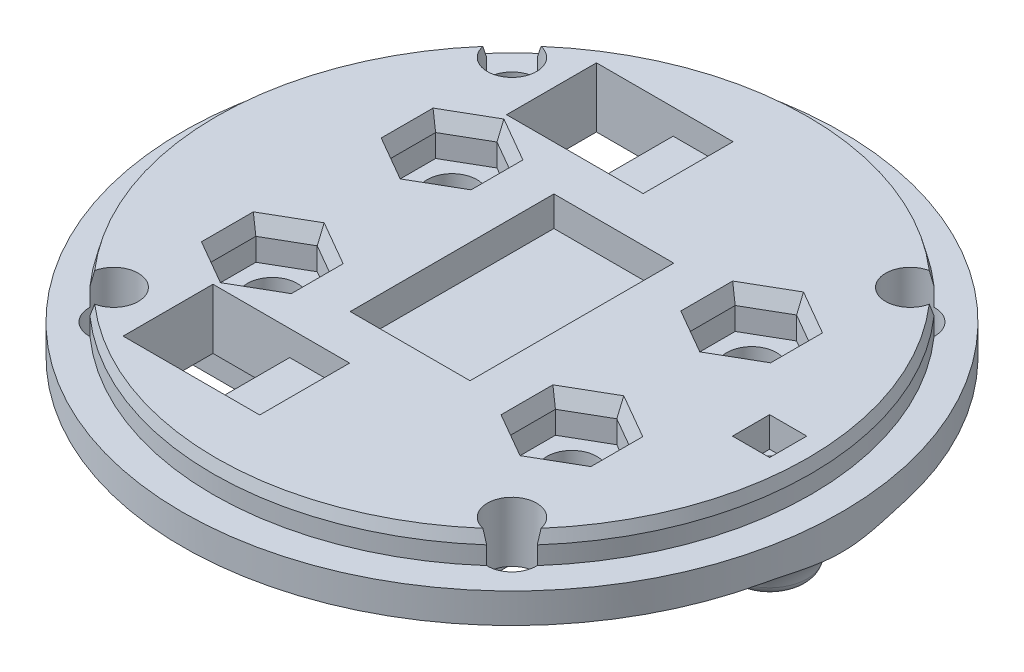
from build123d import *
from OCP.BRepFilletAPI import BRepFilletAPI_MakeChamfer

# Parameters (mm, degrees)
SKETCH_1_R          = 55
EXTRUDE_1_DEPTH     = 5
SKETCH_2_R          = 49.9
EXTRUDE_2_DEPTH     = 5
SKETCH_3_W          = 35
SKETCH_3_H          = 45
EXTRUDE_3_DEPTH     = 25
SKETCH_4_W          = 20.2
SKETCH_4_H          = 10.3
CUT_EXTRUDE_1_DEPTH = 99.266220035
SKETCH_5_R          = 4.1
CUT_EXTRUDE_2_DEPTH = 82.700673192
SKETCH_6_R          = 2.75
CUT_EXTRUDE_3_DEPTH = 86.293610546
CHAMFER1_SIZE       = 2
CHAMFER1_SIZE2      = 0.535898385
SKETCH2_W           = 35.065209797
SKETCH2_H           = 45
CUT_EXTRUDE1_DEPTH  = 12.5
BOSS_EXTRUDE1_START = -2
SKETCH4_W           = 70
SKETCH4_H           = 45
BOSS_EXTRUDE1_DEPTH = 5.35
SKETCH5_R           = 4.15
CUT_EXTRUDE2_DEPTH  = 80.281917882
CUT_EXTRUDE3_DEPTH  = 6.5
SKETCH7_W           = 20
SKETCH7_H           = 34
CUT_EXTRUDE4_DEPTH  = 5
CHAMFER2_SIZE       = 1
CHAMFER2_SIZE2      = 2.747477419
SKETCH8_R           = 2.1
CUT_EXTRUDE5_DEPTH  = 79.779756283
CUT_EXTRUDE5_DRAFT  = 2
SKETCH9_W           = 6.2
SKETCH9_H           = 6.2
CUT_EXTRUDE6_DEPTH  = 5
CHAMFER3_SIZE       = 0.7
CHAMFER3_SIZE2      = 2.128636439
SKETCH10_R          = 6
SKETCH10_R_2        = 3
BOSS_EXTRUDE2_DEPTH = 9
FILLET1_R           = 10
FILLET2_R           = 2
SKETCH11_W          = 12.8
SKETCH11_H          = 15
CUT_EXTRUDE7_DEPTH  = 79.779756353
SKETCH13_W          = 10
SKETCH13_H          = 15
CUT_EXTRUDE8_DEPTH  = 4.2


with BuildPart() as part:
    # Эскиз1 → Бобышка-Вытянуть1 (new body)
    with BuildSketch(Plane(origin=(0, 0, 0), x_dir=(1, 0, 0), z_dir=(0, 1, 0))):
        with Locations(Location((0, 0, 0), (0, 0, 270))):
            Circle(SKETCH_1_R)
    extrude(amount=EXTRUDE_1_DEPTH)

    # Эскиз2 → Бобышка-Вытянуть2 (add)
    with BuildSketch(Plane(origin=(0, 5, 0), x_dir=(1, 0, 0), z_dir=(0, 1, 0))):
        with Locations(Location((0, 0, 0), (0, 0, 270))):
            Circle(SKETCH_2_R)
    extrude(amount=EXTRUDE_2_DEPTH)

    # Эскиз3 → Бобышка-Вытянуть3 (add)
    with BuildSketch(Plane.XZ):
        Rectangle(SKETCH_3_W, SKETCH_3_H)
    extrude(amount=EXTRUDE_3_DEPTH)

    # Эскиз4 → Вырез-Вытянуть1 (cut, through all)
    with BuildSketch(Plane.XY.offset(22.5)):
        with Locations((0, -12.5)):
            Rectangle(SKETCH_4_W, SKETCH_4_H)
    extrude(amount=-CUT_EXTRUDE_1_DEPTH, mode=Mode.SUBTRACT)

    # Эскиз5 → Вырез-Вытянуть2 (cut, through all)
    with BuildSketch(Plane.XZ):
        with Locations(Location((33.234018718, -33.234018718, 0), (0, 0, 270))):
            Circle(SKETCH_5_R)
        with Locations(Location((-33.234018718, -33.234018718, 0), (0, 0, 270))):
            Circle(SKETCH_5_R)
        with Locations(Location((-33.234018718, 33.234018718, 0), (0, 0, 270))):
            Circle(SKETCH_5_R)
        with Locations(Location((33.234018718, 33.234018718, 0), (0, 0, 270))):
            Circle(SKETCH_5_R)
    extrude(amount=-CUT_EXTRUDE_2_DEPTH, mode=Mode.SUBTRACT)

    # Эскиз6 → Вырез-Вытянуть3 (cut, through all)
    with BuildSketch(Plane(origin=(0, 10, 0), x_dir=(1, 0, 0), z_dir=(0, 1, 0))):
        with Locations(Location((-18, 28, 0), (0, 0, 270))):
            Circle(SKETCH_6_R)
    extrude(amount=-CUT_EXTRUDE_3_DEPTH, mode=Mode.SUBTRACT)

    # Chamfer1: one chamfer whose edges measure the first distance from different faces: ONE call of the kernel's chamfer builder (chamfer() names one face for all edges)
    chamfer1_edges_1 = [part.edges().sort_by_distance(p)[0] for p in [
        (0, 10, -49.9),
    ]]
    chamfer1_side_1 = [part.faces().sort_by_distance(p)[0] for p in [
        (0, 7.5, -49.9),
    ]]
    chamfer1_edges_2 = [part.edges().sort_by_distance(p)[0] for p in [
        (-49.9, 10, 0),
    ]]
    chamfer1_side_2 = [part.faces().sort_by_distance(p)[0] for p in [
        (-49.9, 7.5, 0),
    ]]
    chamfer1_edges_3 = [part.edges().sort_by_distance(p)[0] for p in [
        (0, 10, 49.9),
    ]]
    chamfer1_side_3 = [part.faces().sort_by_distance(p)[0] for p in [
        (0, 7.5, 49.9),
    ]]
    chamfer1_edges_4 = [part.edges().sort_by_distance(p)[0] for p in [
        (49.9, 10, 0),
    ]]
    chamfer1_side_4 = [part.faces().sort_by_distance(p)[0] for p in [
        (49.9, 7.5, 0),
    ]]
    chamfer1 = BRepFilletAPI_MakeChamfer(part.part.solid().wrapped)
    for e in chamfer1_edges_1:
        chamfer1.Add(CHAMFER1_SIZE, CHAMFER1_SIZE2, e.wrapped, chamfer1_side_1[0].wrapped)  # the first distance lies on this face
    for e in chamfer1_edges_2:
        chamfer1.Add(CHAMFER1_SIZE, CHAMFER1_SIZE2, e.wrapped, chamfer1_side_2[0].wrapped)  # the first distance lies on this face
    for e in chamfer1_edges_3:
        chamfer1.Add(CHAMFER1_SIZE, CHAMFER1_SIZE2, e.wrapped, chamfer1_side_3[0].wrapped)  # the first distance lies on this face
    for e in chamfer1_edges_4:
        chamfer1.Add(CHAMFER1_SIZE, CHAMFER1_SIZE2, e.wrapped, chamfer1_side_4[0].wrapped)  # the first distance lies on this face
    add(Compound.cast(chamfer1.Shape()), mode=Mode.REPLACE)

    # Sketch2 → Cut-Extrude1 (cut)
    with BuildSketch(Plane.XZ.offset(25)):
        with Locations((-0.032604899, 0)):
            Rectangle(SKETCH2_W, SKETCH2_H)
    extrude(amount=-CUT_EXTRUDE1_DEPTH, mode=Mode.SUBTRACT)

    # Sketch4 → Boss-Extrude1 (add)
    with BuildSketch(Plane.XZ.offset(7.35).offset(BOSS_EXTRUDE1_START)):
        Rectangle(SKETCH4_W, SKETCH4_H)
    extrude(amount=-BOSS_EXTRUDE1_DEPTH)

    # Sketch5 → Cut-Extrude2 (cut, through all)
    with BuildSketch(Plane.XZ.offset(5.35)):
        with Locations((25, 15)):
            Circle(SKETCH5_R)
        with Locations((-25, 15)):
            Circle(SKETCH5_R)
        with Locations((25, -15)):
            Circle(SKETCH5_R)
        with Locations((-25, -15)):
            Circle(SKETCH5_R)
    extrude(amount=-CUT_EXTRUDE2_DEPTH, mode=Mode.SUBTRACT)

    # Sketch6 → Cut-Extrude3 (cut)
    with BuildSketch(Plane(origin=(0, 10, 0), x_dir=(1, 0, 0), z_dir=(0, 1, 0))):
        Polygon((-18.504809472, -11.25), (-25, -7.5), (-31.495190528, -11.25), (-31.495190528, -18.75), (-25, -22.5), (-18.504809472, -18.75), align=None)
        Polygon((31.495190528, -11.25), (25, -7.5), (18.504809472, -11.25), (18.504809472, -18.75), (25, -22.5), (31.495190528, -18.75), align=None)
        Polygon((31.495190528, 18.75), (25, 22.5), (18.504809472, 18.75), (18.504809472, 11.25), (25, 7.5), (31.495190528, 11.25), align=None)
        Polygon((-18.504809472, 18.75), (-25, 22.5), (-31.495190528, 18.75), (-31.495190528, 11.25), (-25, 7.5), (-18.504809472, 11.25), align=None)
    extrude(amount=-CUT_EXTRUDE3_DEPTH, mode=Mode.SUBTRACT)

    # Sketch7 → Cut-Extrude4 (cut)
    with BuildSketch(Plane(origin=(0, 10, 0), x_dir=(1, 0, 0), z_dir=(0, 1, 0))):
        Rectangle(SKETCH7_W, SKETCH7_H)
    extrude(amount=-CUT_EXTRUDE4_DEPTH, mode=Mode.SUBTRACT)

    # Chamfer2
    chamfer2_edges = [part.edges().sort_by_distance(p)[0] for p in [
        (-18.504809472, 10, 15),
        (-21.752404736, 10, 9.375),
        (-28.247595264, 10, 9.375),
        (-31.495190528, 10, 15),
        (-28.247595264, 10, 20.625),
        (-21.752404736, 10, 20.625),
        (31.495190528, 10, 15),
        (28.247595264, 10, 9.375),
        (21.752404736, 10, 9.375),
        (18.504809472, 10, 15),
        (21.752404736, 10, 20.625),
        (28.247595264, 10, 20.625),
        (31.495190528, 10, -15),
        (28.247595264, 10, -20.625),
        (21.752404736, 10, -20.625),
        (18.504809472, 10, -15),
        (21.752404736, 10, -9.375),
        (28.247595264, 10, -9.375),
        (-18.504809472, 10, -15),
        (-21.752404736, 10, -20.625),
        (-28.247595264, 10, -20.625),
        (-31.495190528, 10, -15),
        (-28.247595264, 10, -9.375),
        (-21.752404736, 10, -9.375),
    ]]
    chamfer2_side = [part.faces().sort_by_distance(p)[0] for p in [
        (-27.766928677, 10, 32.668824287),
    ]]
    chamfer(chamfer2_edges, length=CHAMFER2_SIZE, length2=CHAMFER2_SIZE2, reference=chamfer2_side[0])


with BuildPart() as cut_extrude5_tool:
    # Sketch8 → Cut-Extrude5 (with draft: the straight prism first)
    with BuildSketch(Plane.XZ):
        with Locations((43, 0)):
            Circle(SKETCH8_R)
    extrude(amount=-CUT_EXTRUDE5_DEPTH)
    # Cut-Extrude5: the draft: its side faces are tilted about the plane it starts from
    cut_extrude5_sides = [cut_extrude5_tool.faces().sort_by_distance(p)[0] for p in [
        (40.9, 39.889878141, 0),
    ]]
    draft(cut_extrude5_sides, Plane.XZ, CUT_EXTRUDE5_DRAFT)


with BuildPart() as part_1:
    add(part.part)

    # Cut-Extrude5: cut by cut_extrude5_tool
    add(cut_extrude5_tool.part, mode=Mode.SUBTRACT)

    # Sketch9 → Cut-Extrude6 (cut)
    with BuildSketch(Plane(origin=(0, 10, 0), x_dir=(1, 0, 0), z_dir=(0, 1, 0))):
        with Locations((43, 0)):
            Rectangle(SKETCH9_W, SKETCH9_H)
    extrude(amount=-CUT_EXTRUDE6_DEPTH, mode=Mode.SUBTRACT)

    # Chamfer3
    chamfer3_edges = [part_1.edges().sort_by_distance(p)[0] for p in [
        (40.725396153, 5, 0),
    ]]
    chamfer3_side = [part_1.faces().sort_by_distance(p)[0] for p in [
        (43, 5, 3.012318759),
    ]]
    chamfer(chamfer3_edges, length=CHAMFER3_SIZE, length2=CHAMFER3_SIZE2, reference=chamfer3_side[0])

    # Sketch10 → Boss-Extrude2 (add)
    with BuildSketch(Plane.XZ):
        with Locations(Location((43, 0, 0), (0, 0, 90))):
            Circle(SKETCH10_R)
        with Locations(Location((43, 0, 0), (0, 0, 270))):
            Circle(SKETCH10_R_2, mode=Mode.SUBTRACT)
    extrude(amount=BOSS_EXTRUDE2_DEPTH)

    # Fillet1
    # the kernel refuses this fillet: 10 mm, written as the material it adds along each edge
    with BuildSketch(Plane(origin=(43, 0, 0), x_dir=(0, 0, 1), z_dir=(1, 0, 0))) as fillet1_piece_1_section:
        with BuildLine():
            CenterArc((15.949874371, 10), FILLET1_R, 185.739170477, 84.260829523)
            Line((6, 9), (5.801002513, 8.98))
            ThreePointArc((5.801002513, 8.98), (5.8, 4.5), (5.8, 0))
            Line((5.8, 0), (6, -0.2))
            Line((6, -0.2), (15.949874371, -0.2))
            Line((15.949874371, -0.2), (15.949874371, 0))
        make_face()
    fillet1_piece_1 = revolve(axis=Axis((43, 0, 0), (0, -1, 0)), mode=Mode.PRIVATE)
    fillet1_piece_1 = fillet1_piece_1 & Plane(origin=(0, -2.503571207, 0), x_dir=(0, 0, 1), z_dir=(0, -1, 0)) * Cylinder(55, 64, mode=Mode.PRIVATE)
    add(fillet1_piece_1)

    # Fillet2
    fillet2_edges = [part_1.edges().sort_by_distance(p)[0] for p in [
        (43, -9, -6),
    ]]
    fillet(fillet2_edges, radius=FILLET2_R)

    # Sketch11 → Cut-Extrude7 (cut, through all)
    with BuildSketch(Plane.XZ):
        with Locations((-19, -32)):
            Rectangle(SKETCH11_W, SKETCH11_H)
        with Locations((-19, 32)):
            Rectangle(SKETCH11_W, SKETCH11_H)
    extrude(amount=-CUT_EXTRUDE7_DEPTH, mode=Mode.SUBTRACT)

    # Sketch13 → Cut-Extrude8 (cut)
    with BuildSketch(Plane(origin=(0, 10, 0), x_dir=(1, 0, 0), z_dir=(0, 1, 0))):
        with Locations((-7.6, 32)):
            Rectangle(SKETCH13_W, SKETCH13_H)
        with Locations((-7.6, -32)):
            Rectangle(SKETCH13_W, SKETCH13_H)
    extrude(amount=-CUT_EXTRUDE8_DEPTH, mode=Mode.SUBTRACT)


solid = part_1.part
